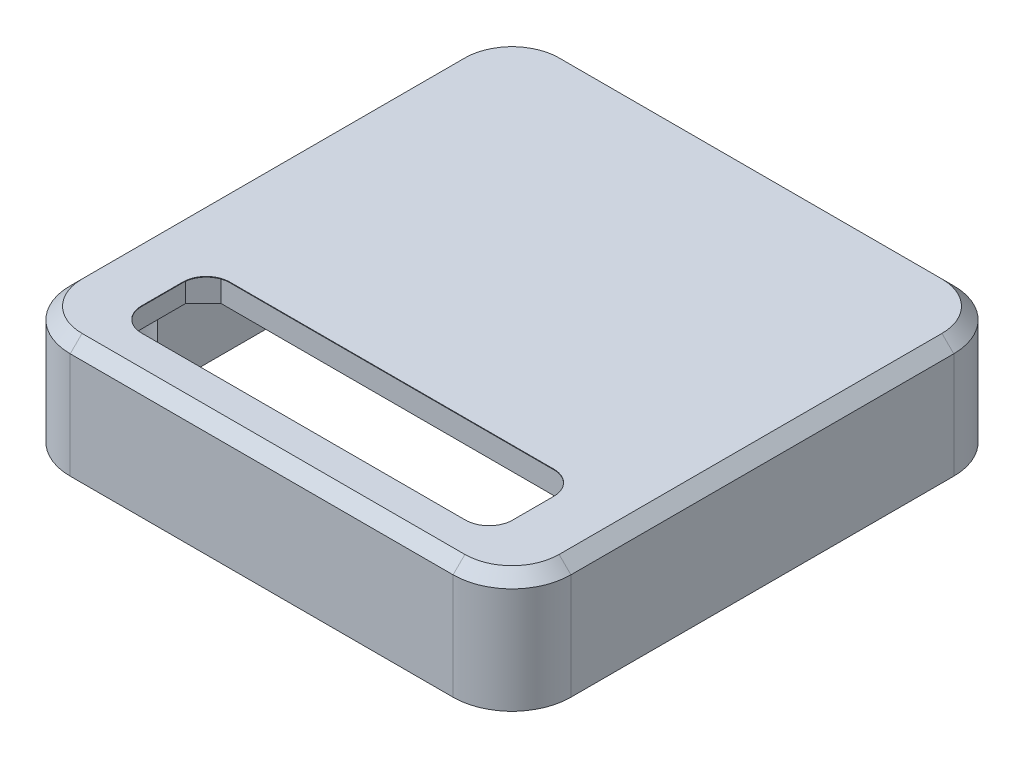
from build123d import *

# Parameters (mm, degrees)
SKETCH1_W           = 85
SKETCH1_H           = 85
BOSS_EXTRUDE1_DEPTH = 20
FILLET1_R           = 10
CHAMFER1_SIZE       = 2
SHELL2_T            = -5
CUT_EXTRUDE1_DEPTH  = 64.344297297
SKETCH3_W           = 15
SKETCH3_H           = 41.8
CUT_EXTRUDE2_DEPTH  = 2
SKETCH3_4_R         = 2
CUT_EXTRUDE3_DEPTH  = 4
BOSS_EXTRUDE2_DEPTH = 0.1
CUT_EXTRUDE9_START  = -15
CUT_EXTRUDE9_DEPTH  = 15
SKETCH17_W          = 10
SKETCH17_H          = 1
CUT_EXTRUDE10_DEPTH = 2
CHAMFER4_SIZE       = 2
SKETCH18_R          = 2
CUT_EXTRUDE11_DEPTH = 3
SKETCH19_W          = 12.1
SKETCH19_H          = 3
BOSS_EXTRUDE8_DEPTH = 2.5
SKETCH20_R          = 2
CUT_EXTRUDE12_DEPTH = 4


with BuildPart() as part:
    # Sketch1 → Boss-Extrude1 (new body)
    with BuildSketch(Plane(origin=(0, 0, 0), x_dir=(1, 0, 0), z_dir=(0, 1, 0))):
        Rectangle(SKETCH1_W, SKETCH1_H)
    extrude(amount=BOSS_EXTRUDE1_DEPTH)

    # Fillet1
    fillet1_edges = [part.edges().sort_by_distance(p)[0] for p in [
        (42.5, 10, 42.5),
        (-42.5, 10, 42.5),
        (-42.5, 10, -42.5),
        (42.5, 10, -42.5),
    ]]
    fillet(fillet1_edges, radius=FILLET1_R)

    # Chamfer1
    chamfer1_edges = [part.edges().sort_by_distance(p)[0] for p in [
        (-42.5, 20, 0),
        (0, 20, -42.5),
        (42.5, 20, 0),
        (0, 20, 42.5),
        (-39.571067812, 20, 39.571067812),
        (39.571067812, 20, 39.571067812),
        (39.571067812, 20, -39.571067812),
        (-39.571067812, 20, -39.571067812),
    ]]
    chamfer(chamfer1_edges, length=CHAMFER1_SIZE)

    # Shell2
    shell2_openings = [part.faces().sort_by_distance(p)[0] for p in [
        (0, 0, 0),
    ]]
    offset(amount=SHELL2_T, openings=shell2_openings, kind=Kind.INTERSECTION)

    # Sketch2 → Cut-Extrude1 (cut, through all)
    with BuildSketch(Plane(origin=(0, 20, 0), x_dir=(1, 0, 0), z_dir=(0, 1, 0))):
        Polygon((-30.1, -36.5), (30.1, -36.5), (33.1, -33.5), (33.1, -22.3), (30.1, -19.3), (-30.1, -19.3), (-33.1, -22.3), (-33.1, -33.5), align=None)
    extrude(amount=-CUT_EXTRUDE1_DEPTH, mode=Mode.SUBTRACT)

    # Sketch3 → Cut-Extrude2 (cut)
    with BuildSketch(Plane.XZ.offset(-15)):
        with Locations((0, -14.6)):
            Rectangle(SKETCH3_W, SKETCH3_H)
    extrude(amount=-CUT_EXTRUDE2_DEPTH, mode=Mode.SUBTRACT)

    # Sketch3<4> → Cut-Extrude3 (cut)
    with BuildSketch(Plane.XZ.offset(-15)):
        with Locations(Location((-3, 10.3, 0), (0, 0, 270))):
            Circle(SKETCH3_4_R)
        with Locations(Location((3, 10.3, 0), (0, 0, 270))):
            Circle(SKETCH3_4_R)
    extrude(amount=-CUT_EXTRUDE3_DEPTH, mode=Mode.SUBTRACT)

    # Sketch4 → Boss-Extrude2 (add)
    with BuildSketch(Plane(origin=(0, 20, 0), x_dir=(1, 0, 0), z_dir=(0, 1, 0))):
        Polygon((-33.1, -33.5), (-33.1, -22.3), (-30.1, -19.3), (30.1, -19.3), (33.1, -22.3), (33.1, -33.5), (30.1, -36.5), (-30.1, -36.5), align=None)
        with BuildLine():
            Line((-31.5, -31.4), (-31.5, -24.4))
            ThreePointArc((-31.5, -24.4), (-30.328427125, -21.571572875), (-27.5, -20.4))
            Line((-27.5, -20.4), (27.5, -20.4))
            ThreePointArc((27.5, -20.4), (30.328427125, -21.571572875), (31.5, -24.4))
            Line((31.5, -24.4), (31.5, -31.4))
            ThreePointArc((31.5, -31.4), (30.328427125, -34.228427125), (27.5, -35.4))
            Line((27.5, -35.4), (-27.5, -35.4))
            ThreePointArc((-27.5, -35.4), (-30.328427125, -34.228427125), (-31.5, -31.4))
        make_face(mode=Mode.SUBTRACT)
    extrude(amount=-BOSS_EXTRUDE2_DEPTH)

    # Sketch5 → Cut-Extrude9 (cut)
    with BuildSketch(Plane.XZ.offset(CUT_EXTRUDE9_START)):
        with BuildLine():
            ThreePointArc((-37.460499109, 33.127254805), (-41.249960643, 27.920806881), (-37.5, 22.685836596))
            Line((-37.5, 22.685836596), (-37.5, 32.5))
            ThreePointArc((-37.5, 32.5), (-37.490115006, 32.814248672), (-37.460499109, 33.127254805))
        make_face()
        with BuildLine():
            Line((37.5, 32.5), (37.5, 22.685836596))
            ThreePointArc((37.5, 22.685836596), (41.249960643, 27.920806881), (37.460499109, 33.127254805))
            ThreePointArc((37.460499109, 33.127254805), (37.490115006, 32.814248672), (37.5, 32.5))
        make_face()
    extrude(amount=CUT_EXTRUDE9_DEPTH, mode=Mode.SUBTRACT)

    # Sketch17 → Cut-Extrude10 (cut)
    with BuildSketch(Plane(origin=(0, 0, 37.5), x_dir=(-1, 0, 0), z_dir=(0, 0, -1))):
        with Locations((-27.460499109, 14.5)):
            Rectangle(SKETCH17_W, SKETCH17_H)
        with Locations((15, 14.5)):
            Rectangle(SKETCH17_W, SKETCH17_H)
    extrude(amount=-CUT_EXTRUDE10_DEPTH, mode=Mode.SUBTRACT)

    # Chamfer4
    chamfer4_edges = [part.edges().sort_by_distance(p)[0] for p in [
        (27.460499109, 14, 37.5),
        (-15, 14, 37.5),
    ]]
    chamfer(chamfer4_edges, length=CHAMFER4_SIZE - 0.0001)  # a hair under: the kernel refuses the full size

    # Sketch18 → Cut-Extrude11 (cut)
    with BuildSketch(Plane.XZ.offset(-15)):
        with Locations(Location((-17.5, 15, 0), (0, 0, 270))):
            Circle(SKETCH18_R)
        with Locations(Location((29.960499109, 15, 0), (0, 0, 270))):
            Circle(SKETCH18_R)
    extrude(amount=-CUT_EXTRUDE11_DEPTH, mode=Mode.SUBTRACT)

    # Sketch19 → Boss-Extrude8 (add)
    with BuildSketch(Plane.XZ.offset(-15)):
        with Locations((0, 15.3)):
            Rectangle(SKETCH19_W, SKETCH19_H)
        Polygon((-6.05, 6.3), (-6.05, 13.8), (-6.05, 16.8), (-9.05, 16.8), (-9.05, 6.3), align=None)
        Polygon((6.05, 16.8), (6.05, 13.8), (6.05, 6.3), (9.05, 6.3), (9.05, 16.8), align=None)
    extrude(amount=BOSS_EXTRUDE8_DEPTH)

    # Sketch20 → Cut-Extrude12 (cut)
    with BuildSketch(Plane.XZ.offset(-15)):
        with Locations(Location((-30.4, -4.6, 0), (0, 0, 270))):
            Circle(SKETCH20_R)
        with Locations(Location((-12.1, -30.4, 0), (0, 0, 270))):
            Circle(SKETCH20_R)
    extrude(amount=-CUT_EXTRUDE12_DEPTH, mode=Mode.SUBTRACT)


solid = part.part
